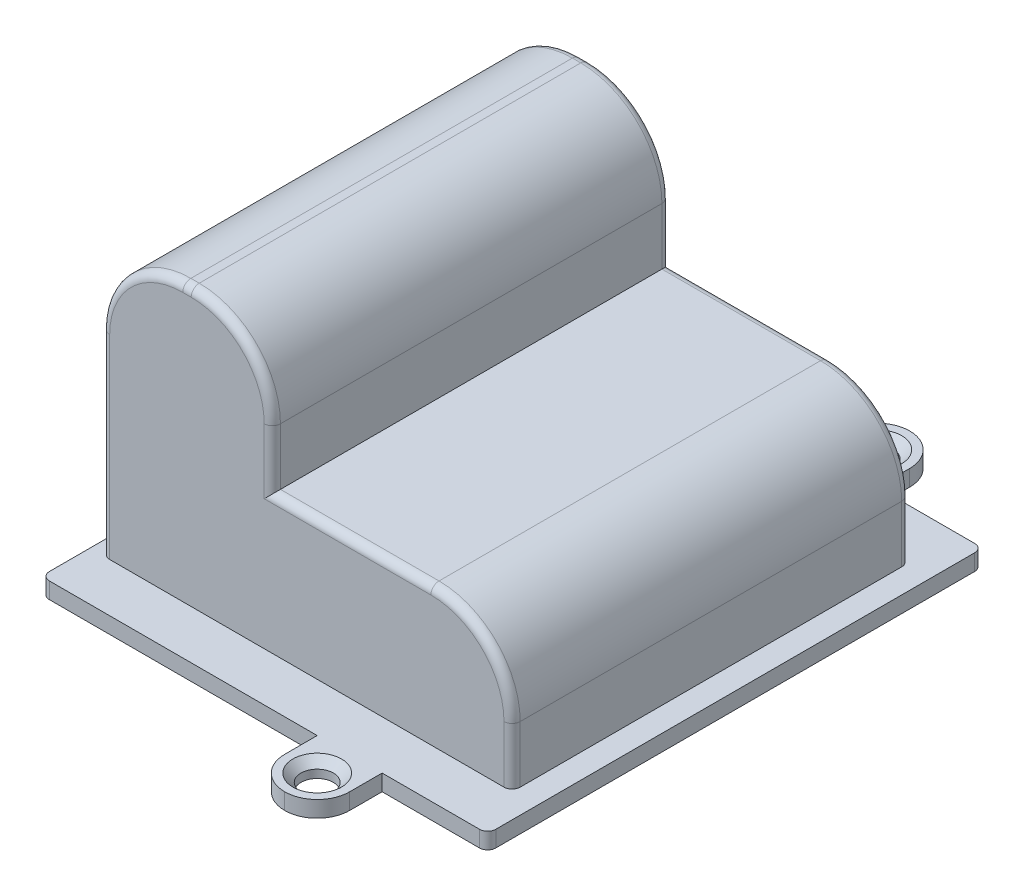
from build123d import *

# Parameters (mm, degrees)
BOSS_EXTRUDE1_DEPTH = 49
FILLET1_R           = 10
FILLET2_R           = 1
SKETCH2_W           = 55
SKETCH2_H           = 6
SKETCH2_W_2         = 8
SKETCH2_H_2         = 8
SKETCH2_R           = 2
BOSS_EXTRUDE2_DEPTH = 2
FILLET3_R           = 4
FILLET4_R           = 1
CHAMFER1_SIZE       = 1


with BuildPart() as part:
    # Sketch1 → Boss-Extrude1 (new body)
    with BuildSketch(Plane.XY):
        Polygon((0, 0), (55, 0), (55, 2), (52.011494253, 2), (52.011494253, 19), (22.471264368, 19), (22.471264368, 36), (1.436781609, 36), (1.436781609, 2), (0, 2), align=None)
    extrude(amount=BOSS_EXTRUDE1_DEPTH)

    # Fillet1
    fillet1_edges = [part.edges().sort_by_distance(p)[0] for p in [
        (1.436781609, 36, 24.5),
        (22.471264368, 36, 24.5),
        (52.011494253, 19, 24.5),
    ]]
    fillet(fillet1_edges, radius=FILLET1_R)

    # Fillet2
    fillet2_edges = [part.edges().sort_by_distance(p)[0] for p in [
        (22.471264368, 22.5, 0),
        (52.011494253, 5.5, 0),
        (52.011494253, 5.5, 49),
        (22.471264368, 22.5, 49),
        (32.24137931, 19, 0),
        (32.24137931, 19, 49),
        (1.436781609, 14, 0),
        (11.954022989, 36, 0),
        (19.54233218, 33.071067812, 0),
        (4.365713797, 33.071067812, 0),
        (49.082562065, 16.071067812, 0),
        (11.954022989, 36, 49),
        (1.436781609, 14, 49),
        (19.54233218, 33.071067812, 49),
        (4.365713797, 33.071067812, 49),
        (49.082562065, 16.071067812, 49),
    ]]
    fillet(fillet2_edges, radius=FILLET2_R)

    # Sketch2 → Boss-Extrude2 (add)
    # profile 1 of 2: a face of its own
    with BuildSketch(Plane.XZ):
        with Locations((27.5, 52)):
            Rectangle(SKETCH2_W, SKETCH2_H)
    # profile 2 of 2: a face of its own
    with BuildSketch(Plane.XZ):
        with Locations((38, 59)):
            Rectangle(SKETCH2_W_2, SKETCH2_H_2)
        with Locations(Location((38, 59, 0), (0, 0, 270))):
            Circle(SKETCH2_R, mode=Mode.SUBTRACT)
    extrude(amount=-BOSS_EXTRUDE2_DEPTH)

    # Fillet3
    fillet3_edges = [part.edges().sort_by_distance(p)[0] for p in [
        (34, 1, 63),
        (42, 1, 63),
    ]]
    fillet(fillet3_edges, radius=FILLET3_R - 0.0001)  # a hair under: the kernel refuses the full size

    # Fillet4
    fillet4_edges = [part.edges().sort_by_distance(p)[0] for p in [
        (0, 1, 55),
        (55, 1, 55),
    ]]
    fillet(fillet4_edges, radius=FILLET4_R)

    # Mirror7: part across plane


with BuildPart() as part_1:
    add(part.part)
    add(part.part.mirror(Plane.XY.offset(24.5)))

    # Chamfer1
    chamfer1_edges = [part_1.edges().sort_by_distance(p)[0] for p in [
        (38, 2, 61),
        (38, 2, -12),
    ]]
    chamfer(chamfer1_edges, length=CHAMFER1_SIZE)


solid = part_1.part
